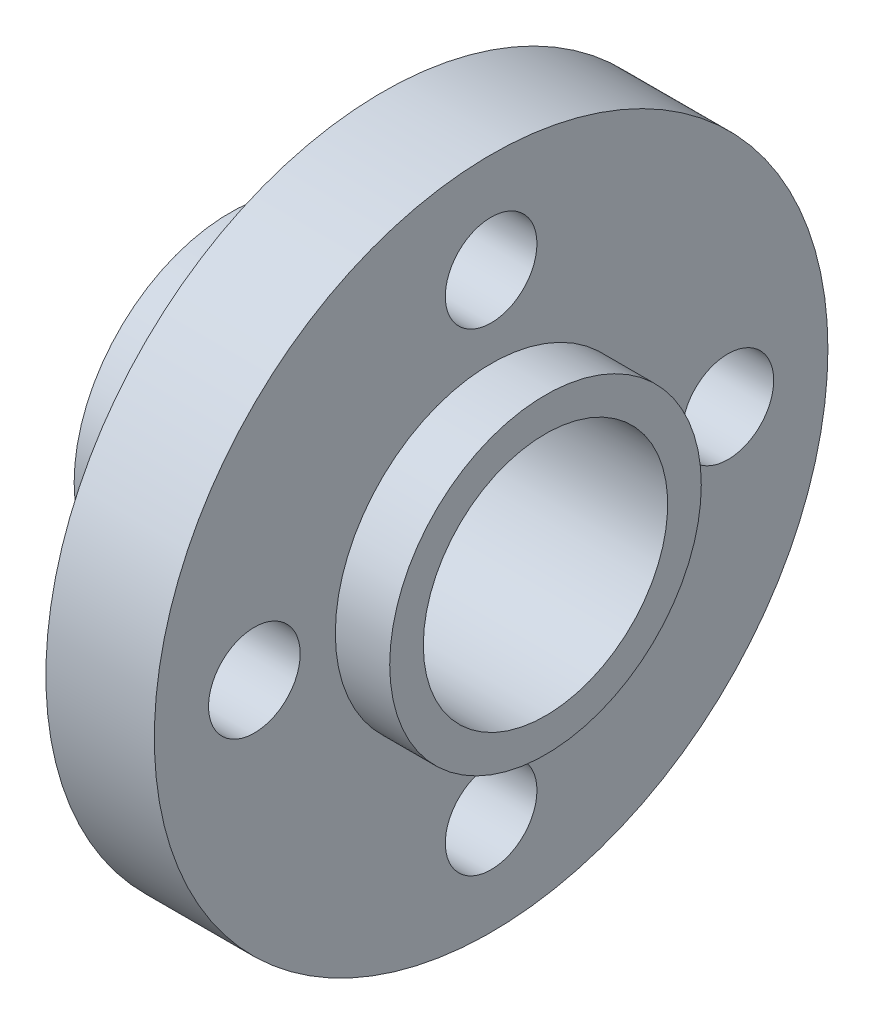
from build123d import *

# Parameters (mm, degrees)
SKETCH1_R           = 11.025
BOSS_EXTRUDE1_DEPTH = 3.55
SKETCH2_R           = 5.1
BOSS_EXTRUDE2_DEPTH = 1.78
BOSS_EXTRUDE3_START = 5
SKETCH3_R           = 5.1
BOSS_EXTRUDE3_DEPTH = 5
SKETCH5_R           = 4
CUT_EXTRUDE1_DEPTH  = 19.703212291
SKETCH6_R           = 1.5
CUT_EXTRUDE2_DEPTH  = 17.477565051
CIRPATTERN1_COUNT   = 4


with BuildPart() as part:
    # Sketch1 → Boss-Extrude1 (new body)
    with BuildSketch(Plane(origin=(0, 0, 0), x_dir=(0, 0, -1), z_dir=(1, 0, 0))):
        Circle(SKETCH1_R)
    extrude(amount=BOSS_EXTRUDE1_DEPTH)

    # Sketch2 → Boss-Extrude2 (add)
    with BuildSketch(Plane(origin=(3.55, 0, 0), x_dir=(0, 0, -1), z_dir=(1, 0, 0))):
        Circle(SKETCH2_R)
    extrude(amount=BOSS_EXTRUDE2_DEPTH)

    # Sketch3 → Boss-Extrude3 (add)
    with BuildSketch(Plane.ZY.offset(BOSS_EXTRUDE3_START)):
        Circle(SKETCH3_R)
    extrude(amount=-BOSS_EXTRUDE3_DEPTH)

    # Sketch5 → Cut-Extrude1 (cut, through all)
    with BuildSketch(Plane.ZY.offset(5)):
        Circle(SKETCH5_R)
    extrude(amount=-CUT_EXTRUDE1_DEPTH, mode=Mode.SUBTRACT)

    # Sketch6 → Cut-Extrude2 (cut, through all)
    with BuildSketch(Plane.ZY):
        with Locations((-7.75, 0)):
            Circle(SKETCH6_R)
    cut_extrude2 = extrude(amount=-CUT_EXTRUDE2_DEPTH, mode=Mode.SUBTRACT)

    # CirPattern1: Cut-Extrude2 ×4 about axis
    cirpattern1_axis = Axis((0, 0, 0), (-1, 0, 0))
    for i in range(1, CIRPATTERN1_COUNT):
        add(cut_extrude2.rotate(cirpattern1_axis, i * 360 / CIRPATTERN1_COUNT), mode=Mode.SUBTRACT)


solid = part.part
